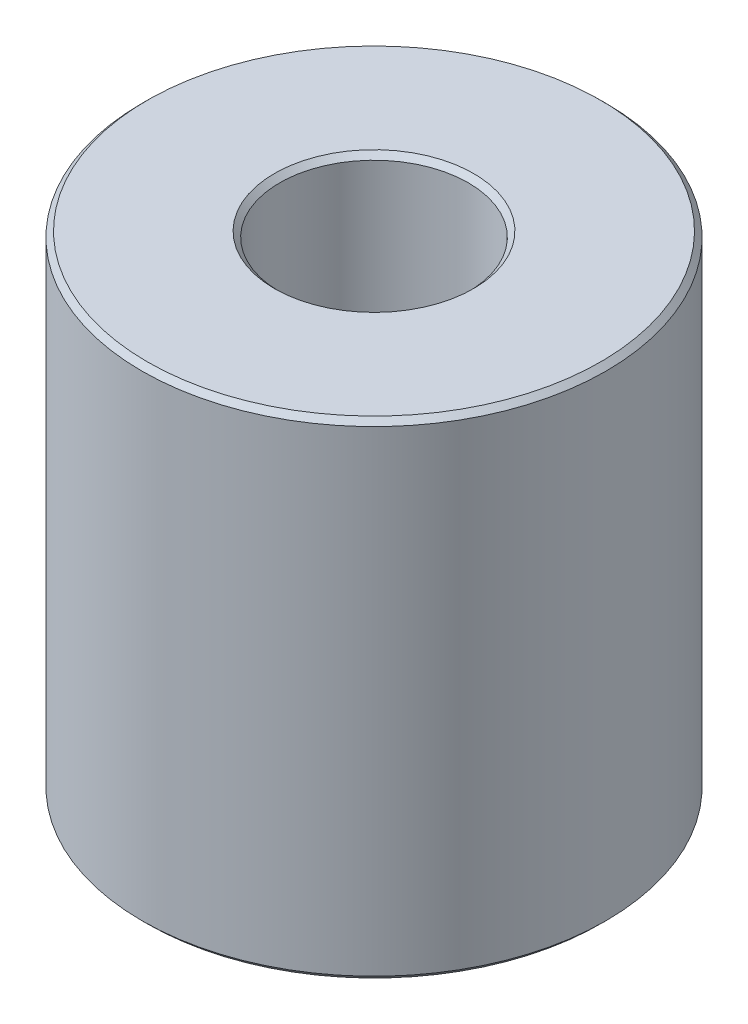
from build123d import *

# Parameters (mm, degrees)
SKETCH1_R           = 55
BOSS_EXTRUDE1_DEPTH = 115.384661435
SKETCH2_R           = 22.364500179
CUT_EXTRUDE1_DEPTH  = 140.153225239
CHAMFER1_SIZE       = 1.267167219


with BuildPart() as part:
    # Sketch1 → Boss-Extrude1 (new body)
    with BuildSketch(Plane(origin=(0, 0, 0), x_dir=(1, 0, 0), z_dir=(0, 1, 0))):
        Circle(SKETCH1_R)
    extrude(amount=BOSS_EXTRUDE1_DEPTH)

    # Sketch2 → Cut-Extrude1 (cut, through all)
    with BuildSketch(Plane(origin=(0, 0, 0), x_dir=(1, 0, 0), z_dir=(0, 1, 0))):
        Circle(SKETCH2_R)
    extrude(amount=CUT_EXTRUDE1_DEPTH, mode=Mode.SUBTRACT)

    # Chamfer1
    chamfer1_edges = [part.edges().sort_by_distance(p)[0] for p in [
        (-22.364500179, 115.384661435, 0),
        (-22.364500179, 0, 0),
        (-55, 0, 0),
        (-55, 115.384661435, 0),
    ]]
    chamfer(chamfer1_edges, length=CHAMFER1_SIZE)


solid = part.part
